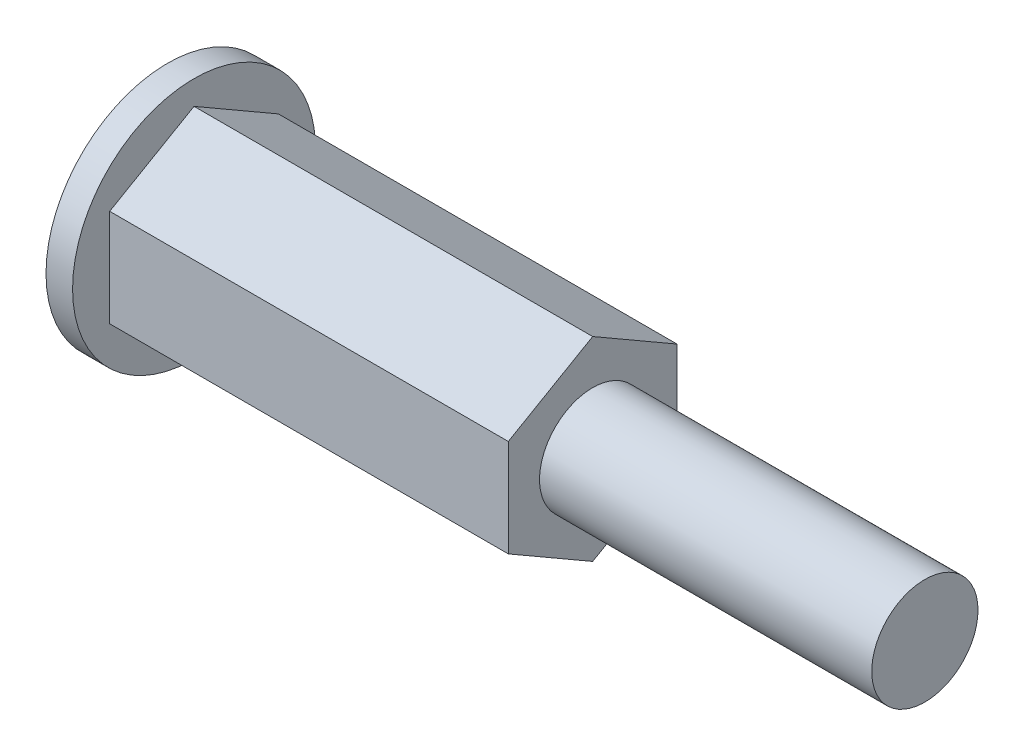
from build123d import *

# Parameters (mm, degrees)
SKETCH1_R           = 3.999
BOSS_EXTRUDE1_DEPTH = 55
SKETCH2_R           = 9.141
BOSS_EXTRUDE2_DEPTH = 2
BOSS_EXTRUDE3_DEPTH = 30


with BuildPart() as part:
    # Sketch1 → Boss-Extrude1 (new body)
    with BuildSketch(Plane.YZ):
        Circle(SKETCH1_R)
    extrude(amount=BOSS_EXTRUDE1_DEPTH)

    # Sketch2 → Boss-Extrude2 (add)
    with BuildSketch(Plane(origin=(0, 0, 0), x_dir=(0, -1, 0), z_dir=(-1, 0, 0))):
        Circle(SKETCH2_R)
    extrude(amount=BOSS_EXTRUDE2_DEPTH)

    # Sketch3 → Boss-Extrude3 (add)
    with BuildSketch(Plane.YZ):
        Polygon((3.665, 6.34796621), (-3.665, 6.34796621), (-7.33, 0), (-3.665, -6.34796621), (3.665, -6.34796621), (7.33, 0), align=None)
    extrude(amount=BOSS_EXTRUDE3_DEPTH)


solid = part.part
